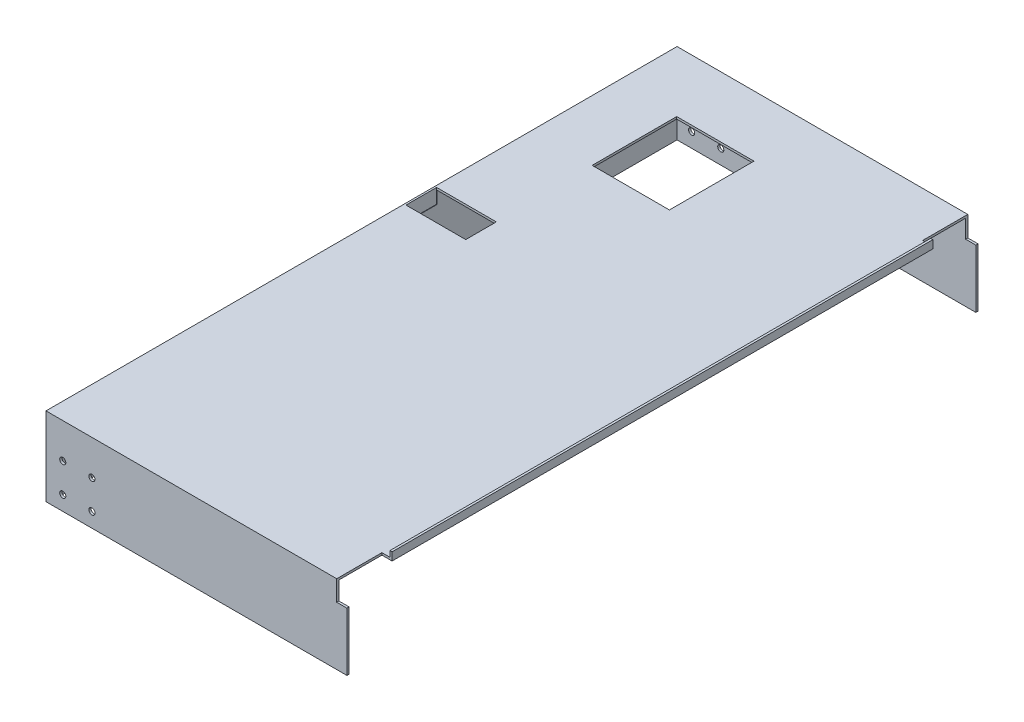
from build123d import *

# Parameters (mm, degrees)
BOSS_EXTRUDE4_DEPTH  = 1.5
SKETCH5_W            = 205
SKETCH5_H            = 54
BOSS_EXTRUDE5_DEPTH  = 1.5
SKETCH8_W            = 1.5
SKETCH8_H            = 430
BOSS_EXTRUDE14_DEPTH = 4
SKETCH7_W            = 205
SKETCH7_H            = 54
BOSS_EXTRUDE18_DEPTH = 1.5
SKETCH9_W            = 433
SKETCH9_H            = 54
BOSS_EXTRUDE19_DEPTH = 1.5
SKETCH10_R           = 2.1
CUT_EXTRUDE1_DEPTH   = 10
CUT_EXTRUDE2_START   = -10
SKETCH17_R           = 2.1
CUT_EXTRUDE2_DEPTH   = 10
SKETCH16_R           = 2.1
CUT_EXTRUDE3_DEPTH   = 10
CUT_EXTRUDE4_START   = -10
SKETCH11_R           = 2.1
CUT_EXTRUDE4_DEPTH   = 10
SKETCH12_R           = 2.1
CUT_EXTRUDE5_DEPTH   = 10
SKETCH13_R           = 2.1
CUT_EXTRUDE6_DEPTH   = 10
CUT_EXTRUDE7_START   = -10
SKETCH14_R           = 2.1
CUT_EXTRUDE7_DEPTH   = 10
CUT_EXTRUDE8_START   = -10
SKETCH15_R           = 2.1
CUT_EXTRUDE8_DEPTH   = 10
SKETCH18_W           = 41
SKETCH18_H           = 21.003646253
CUT_EXTRUDE9_DEPTH   = 10
SKETCH21_W           = 53
SKETCH21_H           = 58
CUT_EXTRUDE12_DEPTH  = 10
SKETCH23_W           = 7
SKETCH23_H           = 18
CUT_EXTRUDE14_DEPTH  = 31
SKETCH24_W           = 7
SKETCH24_H           = 18
CUT_EXTRUDE15_DEPTH  = 31


with BuildPart() as part:
    # Sketch4 → Boss-Extrude4 (new body)
    with BuildSketch(Plane(origin=(0, 0, 0), x_dir=(1, 0, 0), z_dir=(0, 1, 0))):
        Polygon((124.01347733, 430), (329.01347733, 430), (329.01347733, 0), (124.01347733, 0), (124.01347733, 200), (124.01347733, 365), align=None)
    extrude(amount=BOSS_EXTRUDE4_DEPTH)

    # Sketch5 → Boss-Extrude5 (add)
    with BuildSketch(Plane.XY):
        with Locations((226.51347733, -25.5)):
            Rectangle(SKETCH5_W, SKETCH5_H)
    extrude(amount=BOSS_EXTRUDE5_DEPTH)

    # Sketch8 → Boss-Extrude14 (add)
    with BuildSketch(Plane(origin=(0, 1.5, 0), x_dir=(1, 0, 0), z_dir=(0, 1, 0))):
        with Locations((328.26347733, 215)):
            Rectangle(SKETCH8_W, SKETCH8_H)
    extrude(amount=BOSS_EXTRUDE14_DEPTH)

    # Sketch7 → Boss-Extrude18 (add)
    with BuildSketch(Plane(origin=(0, 0, -430), x_dir=(-1, 0, 0), z_dir=(0, 0, -1))):
        with Locations((-226.51347733, -25.5)):
            Rectangle(SKETCH7_W, SKETCH7_H)
    extrude(amount=BOSS_EXTRUDE18_DEPTH)

    # Sketch9 → Boss-Extrude19 (add)
    with BuildSketch(Plane.ZY.offset(-124.01347733)):
        with Locations((-215, -25.5)):
            Rectangle(SKETCH9_W, SKETCH9_H)
    extrude(amount=BOSS_EXTRUDE19_DEPTH)

    # Sketch10 → Cut-Extrude1 (cut)
    with BuildSketch(Plane(origin=(0, 0, -431.5), x_dir=(-1, 0, 0), z_dir=(0, 0, -1))):
        with Locations((-154.01347733, -42.5)):
            Circle(SKETCH10_R)
    extrude(amount=-CUT_EXTRUDE1_DEPTH, mode=Mode.SUBTRACT)

    # Sketch17 → Cut-Extrude2 (cut)
    with BuildSketch(Plane.XY.offset(1.5).offset(CUT_EXTRUDE2_START)):
        with Locations((154.01347733, -42.5)):
            Circle(SKETCH17_R)
    extrude(amount=CUT_EXTRUDE2_DEPTH, mode=Mode.SUBTRACT)

    # Sketch16 → Cut-Extrude3 (cut)
    with BuildSketch(Plane.XY.offset(1.5)):
        with Locations((134.023652304, -42.521836229)):
            Circle(SKETCH16_R)
    extrude(amount=-CUT_EXTRUDE3_DEPTH, mode=Mode.SUBTRACT)

    # Sketch11 → Cut-Extrude4 (cut)
    with BuildSketch(Plane(origin=(0, 0, -431.5), x_dir=(-1, 0, 0), z_dir=(0, 0, -1)).offset(CUT_EXTRUDE4_START)):
        with Locations((-134.023652304, -42.521836229)):
            Circle(SKETCH11_R)
    extrude(amount=CUT_EXTRUDE4_DEPTH, mode=Mode.SUBTRACT)

    # Sketch12 → Cut-Extrude5 (cut)
    with BuildSketch(Plane(origin=(0, 0, -431.5), x_dir=(-1, 0, 0), z_dir=(0, 0, -1))):
        with Locations((-134.017306734, -22.477341223)):
            Circle(SKETCH12_R)
    extrude(amount=-CUT_EXTRUDE5_DEPTH, mode=Mode.SUBTRACT)

    # Sketch13 → Cut-Extrude6 (cut)
    with BuildSketch(Plane(origin=(0, 0, -431.5), x_dir=(-1, 0, 0), z_dir=(0, 0, -1))):
        with Locations((-154.003183789, -22.514424589)):
            Circle(SKETCH13_R)
    extrude(amount=-CUT_EXTRUDE6_DEPTH, mode=Mode.SUBTRACT)

    # Sketch14 → Cut-Extrude7 (cut)
    with BuildSketch(Plane.XY.offset(1.5).offset(CUT_EXTRUDE7_START)):
        with Locations((134.017306734, -22.477341223)):
            Circle(SKETCH14_R)
    extrude(amount=CUT_EXTRUDE7_DEPTH, mode=Mode.SUBTRACT)

    # Sketch15 → Cut-Extrude8 (cut)
    with BuildSketch(Plane.XY.offset(1.5).offset(CUT_EXTRUDE8_START)):
        with Locations((154.003183789, -22.514424589)):
            Circle(SKETCH15_R)
    extrude(amount=CUT_EXTRUDE8_DEPTH, mode=Mode.SUBTRACT)

    # Sketch18 → Cut-Extrude9 (cut)
    with BuildSketch(Plane(origin=(0, 1.5, 0), x_dir=(1, 0, 0), z_dir=(0, 1, 0))):
        with Locations((144.235269619, 254.779446877)):
            Rectangle(SKETCH18_W, SKETCH18_H)
    extrude(amount=-CUT_EXTRUDE9_DEPTH, mode=Mode.SUBTRACT)

    # Sketch21 → Cut-Extrude12 (cut)
    with BuildSketch(Plane(origin=(0, 1.5, 0), x_dir=(1, 0, 0), z_dir=(0, 1, 0))):
        with Locations((190.51347733, 360.765424222)):
            Rectangle(SKETCH21_W, SKETCH21_H)
    extrude(amount=-CUT_EXTRUDE12_DEPTH, mode=Mode.SUBTRACT)

    # Sketch23 → Cut-Extrude14 (cut)
    with BuildSketch(Plane.XY.offset(1.5)):
        with Locations((325.51347733, -3.5)):
            Rectangle(SKETCH23_W, SKETCH23_H)
    extrude(amount=-CUT_EXTRUDE14_DEPTH, mode=Mode.SUBTRACT)

    # Sketch24 → Cut-Extrude15 (cut)
    with BuildSketch(Plane(origin=(0, 0, -431.5), x_dir=(-1, 0, 0), z_dir=(0, 0, -1))):
        with Locations((-325.51347733, -3.5)):
            Rectangle(SKETCH24_W, SKETCH24_H)
    extrude(amount=-CUT_EXTRUDE15_DEPTH, mode=Mode.SUBTRACT)


solid = part.part
